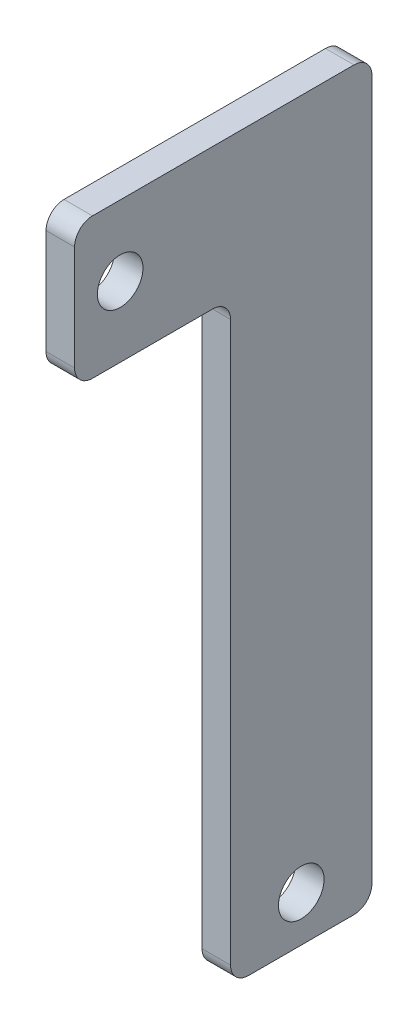
from build123d import *

# Parameters (mm, degrees)
BASE_FLANGE1_DEPTH = 3.175
SKETCH9_R          = 2.54
CUT_EXTRUDE2_DEPTH = 246.387748173
FILLET1_R          = 2


# Sheet-metal steps are written as plain solids
with BuildPart() as part:
    # Sketch2 → Base-Flange1 (new body)
    with BuildSketch(Plane(origin=(-49.425032983, 0, 0), x_dir=(0, 0, -1), z_dir=(1, 0, 0))):
        Polygon((-94.005448243, 127.917372069), (-109.749301699, 127.917372069), (-109.749301699, 194.197401704), (-127.122990112, 194.197401704), (-127.122990112, 209.868558182), (-109.749301699, 209.868558182), (-94.005448243, 209.868558182), align=None)
    extrude(amount=BASE_FLANGE1_DEPTH)

    # Sketch9 → Cut-Extrude2 (cut, through all)
    with BuildSketch(Plane.ZY.offset(49.425032983)):
        with Locations(Location((122.042990112, 202.032979943, 0), (0, 0, 270))):
            Circle(SKETCH9_R)
        with Locations(Location((101.877374971, 132.997372069, 0), (0, 0, 270))):
            Circle(SKETCH9_R)
    extrude(amount=-CUT_EXTRUDE2_DEPTH, mode=Mode.SUBTRACT)

    # Fillet1
    fillet1_edges = [part.edges().sort_by_distance(p)[0] for p in [
        (-47.837532983, 127.917372069, 94.005448243),
        (-47.837532983, 127.917372069, 109.749301699),
        (-47.837532983, 194.197401704, 109.749301699),
        (-47.837532983, 194.197401704, 127.122990112),
        (-47.837532983, 209.868558182, 127.122990112),
        (-47.837532983, 209.868558182, 94.005448243),
    ]]
    fillet(fillet1_edges, radius=FILLET1_R)


solid = part.part
